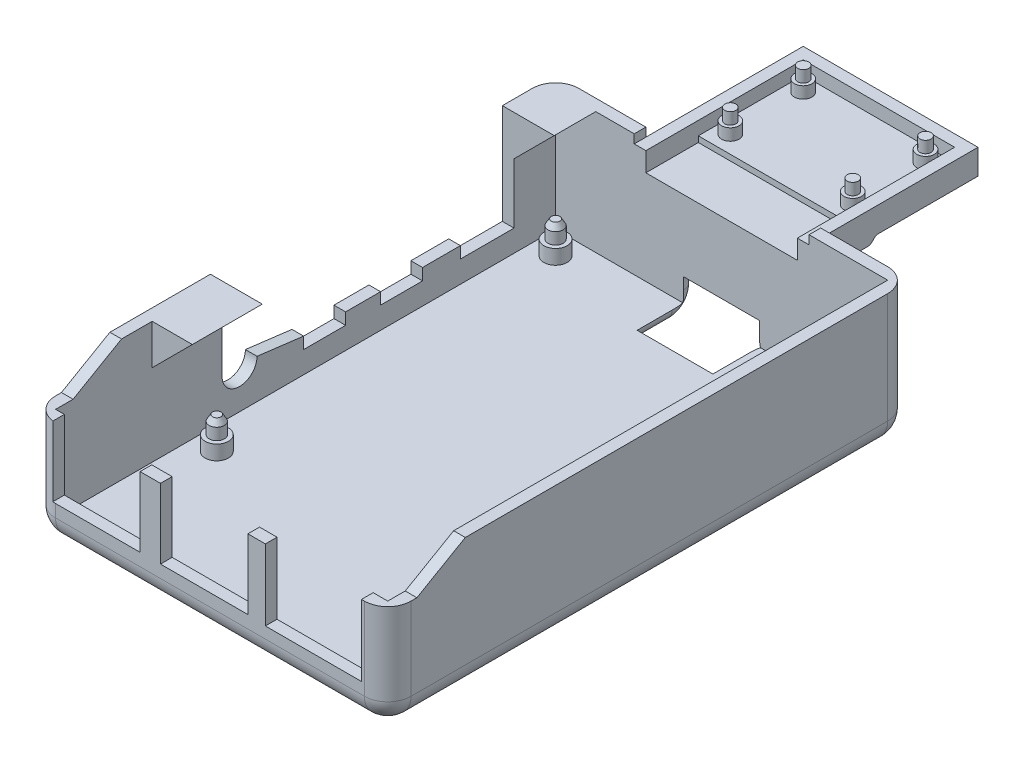
from build123d import *

# Parameters (mm, degrees)
SZKIC1_W                                 = 61
SZKIC1_H                                 = 89.8
DODANIE_WYCI_GNI_CIE1_DEPTH              = 2
SZKIC2_W                                 = 61
SZKIC2_H                                 = 89.8
SZKIC2_W_2                               = 57
SZKIC2_H_2                               = 85.8
DODANIE_WYCI_GNI_CIE2_DEPTH              = 16.15
SZKIC3_W                                 = 15
SZKIC3_H                                 = 12
SZKIC3_W_2                               = 16.5
SZKIC3_H_2                               = 12.2
WYTNIJ_WYCI_GNI_CIE1_DEPTH               = 2
SZKIC4_W                                 = 13
SZKIC4_H                                 = 5.95
WYTNIJ_WYCI_GNI_CIE2_DEPTH               = 10
SZKIC6_R                                 = 3
WYTNIJ_WYCI_GNI_CIE4_DEPTH               = 2
SZKIC7_R                                 = 2
DODANIE_WYCI_GNI_CIE3_DEPTH              = 2.5
SZKIC8_R                                 = 1.3
DODANIE_WYCI_GNI_CIE4_DEPTH              = 2
SZKIC9_R                                 = 1.3
DODANIE_WYCI_GNI_CIE5_DEPTH              = 1
DODANIE_WYCI_GNI_CIE5_TAPER              = 30
LUSTRO2_COPY_1_SKETCH_R                  = 1.3
LUSTRO2_COPY_1_DEPTH                     = 2
LUSTRO2_COPY_2_SKETCH_R                  = 1.3
LUSTRO2_COPY_2_DEPTH                     = 1
LUSTRO2_COPY_2_TAPER                     = 30
SZKIC11_W                                = 2
SZKIC11_H                                = 30.57
DODANIE_WYCI_GNI_CIE6_DEPTH              = 4.8
WYTNIJ_WYCI_GNI_CIE5_DEPTH               = 2
DODANIE_WYCI_GNI_CIE7_DEPTH              = 12
DODANIE_WYCI_GNI_CIE8_DEPTH              = 7.13
WYTNIJ_WYCI_GNI_CIE6_REACH               = 81.144
SZKIC15_W                                = 3.13
SZKIC15_H                                = 4.9
SZKIC15_W_2                              = 10
DODANIE_WYCI_GNI_CIE9_DEPTH              = 3.13
DODANIE_WYCI_GNI_CIE10_DEPTH             = 10
ZAOKR_GLENIE1_R                          = 4
ZAOKR_GLENIE2_R                          = 2
SZKIC18_W                                = 26
SZKIC18_H                                = 2
DODANIE_WYCI_GNI_CIE13_DEPTH             = 8
DODANIE_WYCI_GNI_CIE14_DEPTH             = 26
SZKIC21_R                                = 1.5
ROZMIESZCZENIE_BOLCOW_DEPTH              = 2
SZKIC22_R                                = 0.95
DODANIE_WYCI_GNI_CIE16_DEPTH             = 2
LUSTRO4_COPY_1_SKETCH_R                  = 0.95
LUSTRO4_COPY_1_DEPTH                     = 2
DODANIE_WYCI_GNI_CIE17_DEPTH             = 2
SZKIC25_W                                = 30
SZKIC25_H                                = 2
DODANIE_WYCI_GNI_CIE18_DEPTH             = 2
DODANIE_WYCI_GNI_CIE19_REACH             = 82.415
DODANIE_WYCI_GNI_CIE19_DIRECTION_2_REACH = 82.415
SZKIC27_W                                = 2
SZKIC27_H                                = 4.8
DODANIE_WYCI_GNI_CIE20_DEPTH             = 5.5
DODANIE_WYCI_GNI_CIE21_DEPTH             = 30
WYTNIJ_WYCI_GNI_CIE7_DEPTH               = 1.5
DODANIE_WYCI_GNI_CIE23_DEPTH             = 4.8
DODANIE_WYCI_GNI_CIE24_DEPTH             = 2


with BuildPart() as part:
    # Szkic1 → Dodanie-wyciągnięcie1 (new body)
    with BuildSketch(Plane(origin=(0, 0, 0), x_dir=(1, 0, 0), z_dir=(0, 1, 0))):
        Rectangle(SZKIC1_W, SZKIC1_H)
    extrude(amount=DODANIE_WYCI_GNI_CIE1_DEPTH)

    # Szkic2 → Dodanie-wyciągnięcie2 (add)
    with BuildSketch(Plane(origin=(0, 2, 0), x_dir=(1, 0, 0), z_dir=(0, 1, 0))):
        Rectangle(SZKIC2_W, SZKIC2_H)
        Rectangle(SZKIC2_W_2, SZKIC2_H_2, mode=Mode.SUBTRACT)
    extrude(amount=DODANIE_WYCI_GNI_CIE2_DEPTH)

    # Szkic3 → Wytnij-wyciągnięcie1 (cut)
    with BuildSketch(Plane.XY.offset(44.9)):
        with Locations((-19.5, 12.15)):
            Rectangle(SZKIC3_W, SZKIC3_H)
        with Locations((-1, 12.15)):
            Rectangle(SZKIC3_W, SZKIC3_H)
        with Locations((17.75, 12.05)):
            Rectangle(SZKIC3_W_2, SZKIC3_H_2)
    extrude(amount=-WYTNIJ_WYCI_GNI_CIE1_DEPTH, mode=Mode.SUBTRACT)

    # Szkic4 → Wytnij-wyciągnięcie2 (cut)
    with BuildSketch(Plane(origin=(0, 0, -44.9), x_dir=(-1, 0, 0), z_dir=(0, 0, -1))):
        with Locations((0, 2.975)):
            Rectangle(SZKIC4_W, SZKIC4_H)
    extrude(amount=-WYTNIJ_WYCI_GNI_CIE2_DEPTH, mode=Mode.SUBTRACT)

    # Szkic6 → Wytnij-wyciągnięcie4 (cut)
    with BuildSketch(Plane.ZY.offset(30.5)):
        with BuildLine():
            Line((14.33, 18.15), (-35.77, 18.15))
            Line((-35.77, 18.15), (-35.77, 5.75))
            Line((-35.77, 5.75), (-26.57, 5.75))
            Line((-26.57, 5.75), (-26.57, 7.75))
            Line((-26.57, 7.75), (-20.07, 7.75))
            Line((-20.07, 7.75), (-20.07, 5.75))
            Line((-20.07, 5.75), (-12.87, 5.75))
            Line((-12.87, 5.75), (-12.87, 7.75))
            Line((-12.87, 7.75), (-6.87, 7.75))
            Line((-6.87, 7.75), (-6.87, 5.75))
            Line((-6.87, 5.75), (0.33, 5.75))
            Line((0.33, 5.75), (0.33, 7.75))
            Line((0.33, 7.75), (8.33, 8.75))
            ThreePointArc((8.33, 8.75), (11.33, 11.75), (14.33, 8.75))
            Line((14.33, 8.75), (14.33, 18.15))
        make_face()
        with Locations((11.33, 8.75)):
            Circle(SZKIC6_R)
    extrude(amount=-WYTNIJ_WYCI_GNI_CIE4_DEPTH, mode=Mode.SUBTRACT)

    # Szkic7 → Dodanie-wyciągnięcie3 (add)
    with BuildSketch(Plane(origin=(0, 2, 0), x_dir=(1, 0, 0), z_dir=(0, 1, 0))):
        with Locations(Location((24.57, -19.17, 0), (0, 0, 270))):
            Circle(SZKIC7_R)
        with Locations(Location((-24.57, -19.17, 0), (0, 0, 270))):
            Circle(SZKIC7_R)
        with Locations(Location((24.57, 38.97, 0), (0, 0, 270))):
            Circle(SZKIC7_R)
        with Locations(Location((-24.57, 38.97, 0), (0, 0, 270))):
            Circle(SZKIC7_R)
    extrude(amount=DODANIE_WYCI_GNI_CIE3_DEPTH)

    # Szkic8 → Dodanie-wyciągnięcie4 (add)
    with BuildSketch(Plane(origin=(0, 4.5, 0), x_dir=(1, 0, 0), z_dir=(0, 1, 0))):
        with Locations(Location((-24.57, 38.97, 0), (0, 0, 270))):
            Circle(SZKIC8_R)
    dodanie_wyci_gni_cie4 = extrude(amount=DODANIE_WYCI_GNI_CIE4_DEPTH)

    # Szkic9 → Dodanie-wyciągnięcie5 (add)
    with BuildSketch(Plane(origin=(0, 6.5, 0), x_dir=(1, 0, 0), z_dir=(0, 1, 0))):
        with Locations(Location((-24.57, 38.97, 0), (0, 0, 270))):
            Circle(SZKIC9_R)
    dodanie_wyci_gni_cie5 = extrude(amount=DODANIE_WYCI_GNI_CIE5_DEPTH, taper=DODANIE_WYCI_GNI_CIE5_TAPER)

    # Lustro1: Dodanie-wyciągnięcie4, Dodanie-wyciągnięcie5 across plane
    add(dodanie_wyci_gni_cie4.mirror(Plane.ZY))
    add(dodanie_wyci_gni_cie5.mirror(Plane.ZY))

    # Lustro2: Dodanie-wyciągnięcie4, Dodanie-wyciągnięcie5 across plane
    add(dodanie_wyci_gni_cie4.mirror(Plane.XY.offset(-9.9)))
    add(dodanie_wyci_gni_cie5.mirror(Plane.XY.offset(-9.9)))

    # Lustro2 copy 1 sketch → Lustro2 copy 1 (add)
    with BuildSketch(Plane(origin=(0, 4.5, -19.8), x_dir=(-1, 0, 0), z_dir=(0, 1, 0))):
        with Locations(Location((-24.57, 38.97, 0), (0, 0, 270))):
            Circle(LUSTRO2_COPY_1_SKETCH_R)
    extrude(amount=LUSTRO2_COPY_1_DEPTH)

    # Lustro2 copy 2 sketch → Lustro2 copy 2 (add)
    with BuildSketch(Plane(origin=(0, 6.5, -19.8), x_dir=(-1, 0, 0), z_dir=(0, 1, 0))):
        with Locations(Location((-24.57, 38.97, 0), (0, 0, 270))):
            Circle(LUSTRO2_COPY_2_SKETCH_R)
    extrude(amount=LUSTRO2_COPY_2_DEPTH, taper=LUSTRO2_COPY_2_TAPER)

    # Szkic11 → Dodanie-wyciągnięcie6 (add)
    with BuildSketch(Plane(origin=(0, 18.15, 0), x_dir=(1, 0, 0), z_dir=(0, 1, 0))):
        Polygon((-28.5, 35.77), (-30.5, 35.77), (-30.5, 44.9), (-20.5, 44.9), (-20.5, 42.9), (-28.5, 42.9), align=None)
        with Locations((-29.5, -29.615)):
            Rectangle(SZKIC11_W, SZKIC11_H)
    extrude(amount=DODANIE_WYCI_GNI_CIE6_DEPTH)

    # Szkic12 → Wytnij-wyciągnięcie5 (cut)
    with BuildSketch(Plane.ZY.offset(30.5)):
        Polygon((44.9, 18.15), (39.9, 18.15), (31.586156124, 22.95), (44.9, 22.95), align=None)
    extrude(amount=-WYTNIJ_WYCI_GNI_CIE5_DEPTH, mode=Mode.SUBTRACT)

    # Szkic13 → Dodanie-wyciągnięcie7 (add)
    with BuildSketch(Plane(origin=(0, 0, 14.33), x_dir=(-1, 0, 0), z_dir=(0, 0, -1))):
        Polygon((28.5, 22.95), (21.6, 22.95), (28.5, 16.05), align=None)
    extrude(amount=-DODANIE_WYCI_GNI_CIE7_DEPTH)

    # Szkic14 → Dodanie-wyciągnięcie8 (add)
    with BuildSketch(Plane.XY.offset(-35.77)):
        Polygon((-21.6, 22.95), (-28.5, 22.95), (-28.5, 16.05), align=None)
    extrude(amount=-DODANIE_WYCI_GNI_CIE8_DEPTH)

    # Wytnij-wyciągnięcie6: up to this plane
    wytnij_wyci_gni_cie6_end = Plane(origin=(-21.6, 22.95, 26.33), z_dir=(0.7071067811865437, -0.7071067811865515, 0))
    # Szkic15 → Wytnij-wyciągnięcie6 (cut, up to the surface)
    with BuildSketch(Plane.ZY.offset(30.5), mode=Mode.PRIVATE) as wytnij_wyci_gni_cie6_sk1:
        with Locations((-38.335, 19.5)):
            Rectangle(SZKIC15_W, SZKIC15_H)
    wytnij_wyci_gni_cie6_tool1 = split(extrude(wytnij_wyci_gni_cie6_sk1.sketch, amount=-WYTNIJ_WYCI_GNI_CIE6_REACH, mode=Mode.PRIVATE), bisect_by=wytnij_wyci_gni_cie6_end, keep=Keep.BOTH, mode=Mode.PRIVATE)
    add(wytnij_wyci_gni_cie6_tool1.solids().sort_by_distance((-30.5, 19.5, -38.335))[0], mode=Mode.SUBTRACT)
    # Szkic15 → Wytnij-wyciągnięcie6 (cut, up to the surface)
    with BuildSketch(Plane.ZY.offset(30.5), mode=Mode.PRIVATE) as wytnij_wyci_gni_cie6_sk2:
        with Locations((20.33, 19.5)):
            Rectangle(SZKIC15_W_2, SZKIC15_H)
    wytnij_wyci_gni_cie6_tool2 = split(extrude(wytnij_wyci_gni_cie6_sk2.sketch, amount=-WYTNIJ_WYCI_GNI_CIE6_REACH, mode=Mode.PRIVATE), bisect_by=wytnij_wyci_gni_cie6_end, keep=Keep.BOTH, mode=Mode.PRIVATE)
    add(wytnij_wyci_gni_cie6_tool2.solids().sort_by_distance((-30.5, 19.5, 20.33))[0], mode=Mode.SUBTRACT)

    # Szkic16 → Dodanie-wyciągnięcie9 (add)
    with BuildSketch(Plane.XY.offset(-39.9)):
        Polygon((-27.5, 17.05), (-22.6, 21.95), (-24.014213562, 21.95), (-28.914213562, 17.05), align=None)
    extrude(amount=DODANIE_WYCI_GNI_CIE9_DEPTH)

    # Szkic17 → Dodanie-wyciągnięcie10 (add)
    with BuildSketch(Plane(origin=(0, 0, 25.33), x_dir=(-1, 0, 0), z_dir=(0, 0, -1))):
        Polygon((27.5, 17.05), (28.914213562, 17.05), (24.014213562, 21.95), (22.6, 21.95), align=None)
    extrude(amount=DODANIE_WYCI_GNI_CIE10_DEPTH)

    # Zaokrąglenie1
    zaokr_glenie1_edges = [part.edges().sort_by_distance(p)[0] for p in [
        (-18.5, 0, -44.9),
        (18.5, 0, -44.9),
        (30.5, 0, 0),
        (0, 0, 44.9),
        (-30.5, 0, 0),
        (-30.5, 9.075, 44.9),
        (30.5, 9.075, 44.9),
        (30.5, 9.075, -44.9),
        (-30.5, 11.475, -44.9),
    ]]
    fillet(zaokr_glenie1_edges, radius=ZAOKR_GLENIE1_R)

    # Zaokrąglenie2
    # the kernel refuses this fillet: 2 mm, written as the material it takes off along each edge
    with BuildSketch(Plane(origin=(-6.5, 4, -44.9), x_dir=(-1, 0, 0), z_dir=(0, 1, 0)), Plane(origin=(6.5, 5.95, -44.9), x_dir=(1, 0, 0), z_dir=(0, -1, 0))) as zaokr_glenie2_piece_1:
        with BuildLine():
            CenterArc((ZAOKR_GLENIE2_R, ZAOKR_GLENIE2_R), ZAOKR_GLENIE2_R, 180, 90)
            Line((0, ZAOKR_GLENIE2_R), (0, 0))
            Line((0, 0), (ZAOKR_GLENIE2_R, 0))
        make_face()
    extrude(amount=1.95, mode=Mode.SUBTRACT)
    with BuildSketch(Plane(origin=(-6.5, 4, -40.9), x_dir=(0, 0, -1), z_dir=(0, 1, 0))) as zaokr_glenie2_piece_2:
        with BuildLine():
            CenterArc((4 - ZAOKR_GLENIE2_R, ZAOKR_GLENIE2_R), ZAOKR_GLENIE2_R, 270, 90)
            Line((4 - ZAOKR_GLENIE2_R, 0), (4, 0))
            Line((4, 0), (4, ZAOKR_GLENIE2_R))
        make_face()
    revolve(axis=Axis((-6.5, 4, -40.9), (-1, 0, 0)), revolution_arc=90, mode=Mode.SUBTRACT)
    with BuildSketch(Plane(origin=(6.5, 4, -40.9), x_dir=(0, 0, -1), z_dir=(0, 1, 0))) as zaokr_glenie2_piece_3:
        with BuildLine():
            CenterArc((4 - ZAOKR_GLENIE2_R, -ZAOKR_GLENIE2_R), ZAOKR_GLENIE2_R, 0, 90)
            Line((4 - ZAOKR_GLENIE2_R, 0), (4, 0))
            Line((4, 0), (4, -ZAOKR_GLENIE2_R))
        make_face()
    revolve(axis=Axis((6.5, 4, -40.9), (-1, 0, 0)), revolution_arc=90, mode=Mode.SUBTRACT)
    with BuildSketch(Plane(origin=(-6.5, 5.95, -44.9), x_dir=(0, 1, 0), z_dir=(1, 0, 0)), Plane(origin=(6.5, 0, -34.9), x_dir=(0, 0, 1), z_dir=(-1, 0, 0))) as zaokr_glenie2_piece_4:
        with BuildLine():
            CenterArc((ZAOKR_GLENIE2_R, ZAOKR_GLENIE2_R), ZAOKR_GLENIE2_R, 180, 90)
            Line((0, ZAOKR_GLENIE2_R), (0, 0))
            Line((0, 0), (ZAOKR_GLENIE2_R, 0))
        make_face()
    extrude(amount=13, mode=Mode.SUBTRACT)
    with BuildSketch(Plane(origin=(-6.5, 0, -40.9), x_dir=(0, 1, 0), z_dir=(0, 0, 1))) as zaokr_glenie2_piece_5:
        with BuildLine():
            CenterArc((ZAOKR_GLENIE2_R, ZAOKR_GLENIE2_R), ZAOKR_GLENIE2_R, 180, 90)
            Line((0, ZAOKR_GLENIE2_R), (0, 0))
            Line((0, 0), (ZAOKR_GLENIE2_R, 0))
        make_face()
    extrude(amount=6, mode=Mode.SUBTRACT)
    with BuildSketch(Plane(origin=(6.5, 0, -40.9), x_dir=(0, 1, 0), z_dir=(0, 0, 1))) as zaokr_glenie2_piece_6:
        with BuildLine():
            CenterArc((ZAOKR_GLENIE2_R, -ZAOKR_GLENIE2_R), ZAOKR_GLENIE2_R, 90, 90)
            Line((0, -ZAOKR_GLENIE2_R), (0, 0))
            Line((0, 0), (ZAOKR_GLENIE2_R, 0))
        make_face()
    extrude(amount=6, mode=Mode.SUBTRACT)
    with BuildSketch(Plane(origin=(-6.5, 4, -44.9), x_dir=(-1, 0, 0), z_dir=(0, 1, 0))) as zaokr_glenie2_piece_7a_section:
        with BuildLine():
            CenterArc((ZAOKR_GLENIE2_R, ZAOKR_GLENIE2_R), ZAOKR_GLENIE2_R, 180, 90)
            Line((0, ZAOKR_GLENIE2_R), (0, 0))
            Line((0, 0), (ZAOKR_GLENIE2_R, 0))
        make_face()
    zaokr_glenie2_piece_7a = extrude(amount=6.95, mode=Mode.PRIVATE)
    zaokr_glenie2_piece_7a = split(zaokr_glenie2_piece_7a, bisect_by=Plane(origin=(-6.952790229, 5.95, -44.447209771), z_dir=(0, 1, 0)), keep=Keep.TOP, mode=Mode.PRIVATE)
    with BuildSketch(Plane(origin=(-11.5, 5.95, -44.9), x_dir=(0, 1, 0), z_dir=(1, 0, 0))) as zaokr_glenie2_piece_7b_section:
        with BuildLine():
            CenterArc((ZAOKR_GLENIE2_R, ZAOKR_GLENIE2_R), ZAOKR_GLENIE2_R, 180, 90)
            Line((0, ZAOKR_GLENIE2_R), (0, 0))
            Line((0, 0), (ZAOKR_GLENIE2_R, 0))
        make_face()
    zaokr_glenie2_piece_7b = extrude(amount=18, mode=Mode.PRIVATE)
    zaokr_glenie2_piece_7b = split(zaokr_glenie2_piece_7b, bisect_by=Plane(origin=(-6.5, 6.402790229, -44.447209771), z_dir=(-1, 0, 0)), keep=Keep.TOP, mode=Mode.PRIVATE)
    zaokr_glenie2_piece_7 = zaokr_glenie2_piece_7a & zaokr_glenie2_piece_7b
    add(zaokr_glenie2_piece_7, mode=Mode.SUBTRACT)
    with BuildSketch(Plane(origin=(-6.5, 5.95, -44.9), x_dir=(0, 1, 0), z_dir=(1, 0, 0))) as zaokr_glenie2_piece_8a_section:
        with BuildLine():
            CenterArc((ZAOKR_GLENIE2_R, ZAOKR_GLENIE2_R), ZAOKR_GLENIE2_R, 180, 90)
            Line((0, ZAOKR_GLENIE2_R), (0, 0))
            Line((0, 0), (ZAOKR_GLENIE2_R, 0))
        make_face()
    zaokr_glenie2_piece_8a = extrude(amount=18, mode=Mode.PRIVATE)
    zaokr_glenie2_piece_8a = split(zaokr_glenie2_piece_8a, bisect_by=Plane(origin=(6.5, 6.402790229, -44.447209771), z_dir=(1, 0, 0)), keep=Keep.TOP, mode=Mode.PRIVATE)
    with BuildSketch(Plane(origin=(6.5, 10.95, -44.9), x_dir=(1, 0, 0), z_dir=(0, -1, 0))) as zaokr_glenie2_piece_8b_section:
        with BuildLine():
            CenterArc((ZAOKR_GLENIE2_R, ZAOKR_GLENIE2_R), ZAOKR_GLENIE2_R, 180, 90)
            Line((0, ZAOKR_GLENIE2_R), (0, 0))
            Line((0, 0), (ZAOKR_GLENIE2_R, 0))
        make_face()
    zaokr_glenie2_piece_8b = extrude(amount=6.95, mode=Mode.PRIVATE)
    zaokr_glenie2_piece_8b = split(zaokr_glenie2_piece_8b, bisect_by=Plane(origin=(6.952790229, 5.95, -44.447209771), z_dir=(0, 1, 0)), keep=Keep.TOP, mode=Mode.PRIVATE)
    zaokr_glenie2_piece_8 = zaokr_glenie2_piece_8a & zaokr_glenie2_piece_8b
    add(zaokr_glenie2_piece_8, mode=Mode.SUBTRACT)
    with BuildSketch(Plane(origin=(-6.5, 0, -40.9), x_dir=(0, 1, 0), z_dir=(0, 0, 1))) as zaokr_glenie2_piece_9a_section:
        with BuildLine():
            CenterArc((ZAOKR_GLENIE2_R, ZAOKR_GLENIE2_R), ZAOKR_GLENIE2_R, 180, 90)
            Line((0, ZAOKR_GLENIE2_R), (0, 0))
            Line((0, 0), (ZAOKR_GLENIE2_R, 0))
        make_face()
    zaokr_glenie2_piece_9a = extrude(amount=11, mode=Mode.PRIVATE)
    zaokr_glenie2_piece_9a = split(zaokr_glenie2_piece_9a, bisect_by=Plane(origin=(-6.952790229, 0.452790229, -34.9), z_dir=(0, 0, 1)), keep=Keep.TOP, mode=Mode.PRIVATE)
    with BuildSketch(Plane(origin=(6.5, 0, -34.9), x_dir=(0, 0, 1), z_dir=(-1, 0, 0))) as zaokr_glenie2_piece_9b_section:
        with BuildLine():
            CenterArc((ZAOKR_GLENIE2_R, ZAOKR_GLENIE2_R), ZAOKR_GLENIE2_R, 180, 90)
            Line((0, ZAOKR_GLENIE2_R), (0, 0))
            Line((0, 0), (ZAOKR_GLENIE2_R, 0))
        make_face()
    zaokr_glenie2_piece_9b = extrude(amount=18, mode=Mode.PRIVATE)
    zaokr_glenie2_piece_9b = split(zaokr_glenie2_piece_9b, bisect_by=Plane(origin=(-6.5, 0.452790229, -34.447209771), z_dir=(-1, 0, 0)), keep=Keep.TOP, mode=Mode.PRIVATE)
    zaokr_glenie2_piece_9 = zaokr_glenie2_piece_9a & zaokr_glenie2_piece_9b
    add(zaokr_glenie2_piece_9, mode=Mode.SUBTRACT)
    with BuildSketch(Plane(origin=(6.5, 0, -40.9), x_dir=(0, 1, 0), z_dir=(0, 0, 1))) as zaokr_glenie2_piece_10a_section:
        with BuildLine():
            CenterArc((ZAOKR_GLENIE2_R, -ZAOKR_GLENIE2_R), ZAOKR_GLENIE2_R, 90, 90)
            Line((0, -ZAOKR_GLENIE2_R), (0, 0))
            Line((0, 0), (ZAOKR_GLENIE2_R, 0))
        make_face()
    zaokr_glenie2_piece_10a = extrude(amount=11, mode=Mode.PRIVATE)
    zaokr_glenie2_piece_10a = split(zaokr_glenie2_piece_10a, bisect_by=Plane(origin=(6.952790229, 0.452790229, -34.9), z_dir=(0, 0, 1)), keep=Keep.TOP, mode=Mode.PRIVATE)
    with BuildSketch(Plane(origin=(11.5, 0, -34.9), x_dir=(0, 0, 1), z_dir=(-1, 0, 0))) as zaokr_glenie2_piece_10b_section:
        with BuildLine():
            CenterArc((ZAOKR_GLENIE2_R, ZAOKR_GLENIE2_R), ZAOKR_GLENIE2_R, 180, 90)
            Line((0, ZAOKR_GLENIE2_R), (0, 0))
            Line((0, 0), (ZAOKR_GLENIE2_R, 0))
        make_face()
    zaokr_glenie2_piece_10b = extrude(amount=18, mode=Mode.PRIVATE)
    zaokr_glenie2_piece_10b = split(zaokr_glenie2_piece_10b, bisect_by=Plane(origin=(6.5, 0.452790229, -34.447209771), z_dir=(1, 0, 0)), keep=Keep.TOP, mode=Mode.PRIVATE)
    zaokr_glenie2_piece_10 = zaokr_glenie2_piece_10a & zaokr_glenie2_piece_10b
    add(zaokr_glenie2_piece_10, mode=Mode.SUBTRACT)

    # Szkic18 → Dodanie-wyciągnięcie13 (add)
    with BuildSketch(Plane(origin=(0, 0, -44.9), x_dir=(-1, 0, 0), z_dir=(0, 0, -1))):
        with Locations((0, 17.15)):
            Rectangle(SZKIC18_W, SZKIC18_H)
    extrude(amount=DODANIE_WYCI_GNI_CIE13_DEPTH)

    # Szkic20 → Dodanie-wyciągnięcie14 (add)
    with BuildSketch(Plane(origin=(13, 0, 0), x_dir=(0, 0, -1), z_dir=(1, 0, 0))):
        Polygon((52.9, 17.15), (69.9, 17.15), (69.9, 19.15), (51.9, 19.15), (51.9, 18.15), (52.9, 18.15), align=None)
    extrude(amount=-DODANIE_WYCI_GNI_CIE14_DEPTH)

    # Szkic21 → ROZMIESZCZENIE BOLCOW (add)
    with BuildSketch(Plane(origin=(0, 19.15, 0), x_dir=(1, 0, 0), z_dir=(0, 1, 0))):
        with Locations(Location((10.5, 67.4, 0), (0, 0, 270))):
            Circle(SZKIC21_R)
        with Locations(Location((10.5, 54.9, 0), (0, 0, 270))):
            Circle(SZKIC21_R)
        with Locations(Location((-10.5, 67.4, 0), (0, 0, 270))):
            Circle(SZKIC21_R)
        with Locations(Location((-10.5, 54.9, 0), (0, 0, 270))):
            Circle(SZKIC21_R)
    extrude(amount=ROZMIESZCZENIE_BOLCOW_DEPTH)

    # Szkic22 → Dodanie-wyciągnięcie16 (add)
    with BuildSketch(Plane(origin=(0, 21.15, 0), x_dir=(1, 0, 0), z_dir=(0, 1, 0))):
        with Locations(Location((-10.5, 67.4, 0), (0, 0, 270))):
            Circle(SZKIC22_R)
    dodanie_wyci_gni_cie16 = extrude(amount=DODANIE_WYCI_GNI_CIE16_DEPTH)

    # Lustro3: Dodanie-wyciągnięcie16 across plane
    add(dodanie_wyci_gni_cie16.mirror(Plane(origin=(0, 0, 0), x_dir=(0, 0, 1), z_dir=(1, 0, 0))))

    # Lustro4: Dodanie-wyciągnięcie16 across plane
    add(dodanie_wyci_gni_cie16.mirror(Plane(origin=(0, 0, -61.15), x_dir=(1, 0, 0), z_dir=(0, 0, -1))))

    # Lustro4 copy 1 sketch → Lustro4 copy 1 (add)
    with BuildSketch(Plane(origin=(0, 21.15, -122.3), x_dir=(-1, 0, 0), z_dir=(0, 1, 0))):
        with Locations(Location((-10.5, 67.4, 0), (0, 0, 270))):
            Circle(LUSTRO4_COPY_1_SKETCH_R)
    extrude(amount=LUSTRO4_COPY_1_DEPTH)

    # Szkic24 → Dodanie-wyciągnięcie17 (add)
    with BuildSketch(Plane.ZY.offset(13)):
        Polygon((-44.9, 18.15), (-51.9, 18.15), (-51.9, 19.15), (-69.9, 19.15), (-69.9, 17.15), (-52.9, 17.15), (-52.9, 16.15), (-44.9, 16.15), align=None)
    dodanie_wyci_gni_cie17 = extrude(amount=DODANIE_WYCI_GNI_CIE17_DEPTH)

    # Lustro5: Dodanie-wyciągnięcie17 across plane
    add(dodanie_wyci_gni_cie17.mirror(Plane(origin=(0, 0, 0), x_dir=(0, 0, 1), z_dir=(1, 0, 0))))

    # Szkic25 → Dodanie-wyciągnięcie18 (add)
    with BuildSketch(Plane(origin=(0, 0, -69.9), x_dir=(-1, 0, 0), z_dir=(0, 0, -1))):
        with Locations((0, 18.15)):
            Rectangle(SZKIC25_W, SZKIC25_H)
    extrude(amount=DODANIE_WYCI_GNI_CIE18_DEPTH)

    # Dodanie-wyciągnięcie19: up to this face of the body (flat: up to its plane)
    dodanie_wyci_gni_cie19_end = Plane(part.part.faces().sort_by_distance((-25.759937238, 22.95, -40.275471549))[0])
    # Szkic26 → Dodanie-wyciągnięcie19 (add, up to the picked face)
    with BuildSketch(Plane(origin=(0, 19.15, 0), x_dir=(1, 0, 0), z_dir=(0, 1, 0)), mode=Mode.PRIVATE) as dodanie_wyci_gni_cie19_sk1:
        Polygon((15, 51.9), (15, 44.9), (15, 42.9), (13, 42.9), (13, 69.9), (-13, 69.9), (-13, 42.9), (-15, 42.9), (-15, 44.9), (-15, 51.9), (-15, 71.9), (15, 71.9), align=None)
    dodanie_wyci_gni_cie19_tool1 = split(extrude(dodanie_wyci_gni_cie19_sk1.sketch, amount=DODANIE_WYCI_GNI_CIE19_REACH, mode=Mode.PRIVATE), bisect_by=dodanie_wyci_gni_cie19_end, keep=Keep.BOTH, mode=Mode.PRIVATE)
    add(dodanie_wyci_gni_cie19_tool1.solids().sort_by(Axis((14.582747, 19.15, -48.4), (0, 1, 0)))[0])

    # Dodanie-wyciągnięcie19 direction 2: up to this face of the body (flat: up to its plane)
    dodanie_wyci_gni_cie19_direction_2_end = Plane(part.part.faces().sort_by_distance((-28.911855149, 18.15, 42.295187734))[0])
    # Szkic26 → Dodanie-wyciągnięcie19 direction 2 (add, up to the picked face)
    with BuildSketch(Plane(origin=(0, 19.15, 0), x_dir=(1, 0, 0), z_dir=(0, 1, 0)), mode=Mode.PRIVATE) as dodanie_wyci_gni_cie19_direction_2_sk1:
        Polygon((15, 51.9), (15, 44.9), (15, 42.9), (13, 42.9), (13, 69.9), (-13, 69.9), (-13, 42.9), (-15, 42.9), (-15, 44.9), (-15, 51.9), (-15, 71.9), (15, 71.9), align=None)
    dodanie_wyci_gni_cie19_direction_2_tool1 = split(extrude(dodanie_wyci_gni_cie19_direction_2_sk1.sketch, amount=-DODANIE_WYCI_GNI_CIE19_DIRECTION_2_REACH, mode=Mode.PRIVATE), bisect_by=dodanie_wyci_gni_cie19_direction_2_end, keep=Keep.BOTH, mode=Mode.PRIVATE)
    add(dodanie_wyci_gni_cie19_direction_2_tool1.solids().sort_by(Axis((14.582747, 19.15, -48.4), (0, -1, 0)))[0])

    # Szkic27 → Dodanie-wyciągnięcie20 (add)
    with BuildSketch(Plane(origin=(-20.5, 0, 0), x_dir=(0, 0, -1), z_dir=(1, 0, 0))):
        with Locations((43.9, 20.55)):
            Rectangle(SZKIC27_W, SZKIC27_H)
    extrude(amount=DODANIE_WYCI_GNI_CIE20_DEPTH)

    # Szkic28 → Dodanie-wyciągnięcie21 (add)
    with BuildSketch(Plane.ZY.offset(15)):
        with BuildLine():
            Line((-52.9, 17.15), (-54.9, 17.15))
            ThreePointArc((-54.9, 17.15), (-54.340983006, 17.018033989), (-53.9, 16.65))
            ThreePointArc((-53.9, 16.65), (-53.459016994, 16.281966011), (-52.9, 16.15))
            Line((-52.9, 16.15), (-52.9, 17.15))
        make_face()
    extrude(amount=-DODANIE_WYCI_GNI_CIE21_DEPTH)

    # Szkic29 → Wytnij-wyciągnięcie7 (cut)
    with BuildSketch(Plane(origin=(0, 22.95, 0), x_dir=(1, 0, 0), z_dir=(0, 1, 0))):
        Polygon((-15, 71.9), (-15, 44.9), (-15, 42.9), (-13, 42.9), (-13, 69.9), (13, 69.9), (13, 42.9), (15, 42.9), (15, 71.9), align=None)
    extrude(amount=-WYTNIJ_WYCI_GNI_CIE7_DEPTH, mode=Mode.SUBTRACT)

    # Szkic30 → Dodanie-wyciągnięcie23 (add)
    with BuildSketch(Plane(origin=(0, 18.15, 0), x_dir=(1, 0, 0), z_dir=(0, 1, 0))):
        with BuildLine():
            Line((28.5, -31.586156124), (30.5, -31.586156124))
            Line((30.5, -31.586156124), (30.5, 40.9))
            ThreePointArc((30.5, 40.9), (29.328427125, 43.728427125), (26.5, 44.9))
            Line((26.5, 44.9), (15, 44.9))
            Line((15, 44.9), (15, 42.9))
            Line((15, 42.9), (28.5, 42.9))
            Line((28.5, 42.9), (28.5, -31.586156124))
        make_face()
    extrude(amount=DODANIE_WYCI_GNI_CIE23_DEPTH)

    # Szkic31 → Dodanie-wyciągnięcie24 (add)
    with BuildSketch(Plane(origin=(30.5, 0, 0), x_dir=(0, 0, -1), z_dir=(1, 0, 0))):
        Polygon((-31.586156124, 22.95), (-39.9, 18.15), (-31.586156124, 18.15), align=None)
    extrude(amount=-DODANIE_WYCI_GNI_CIE24_DEPTH)


solid = part.part
